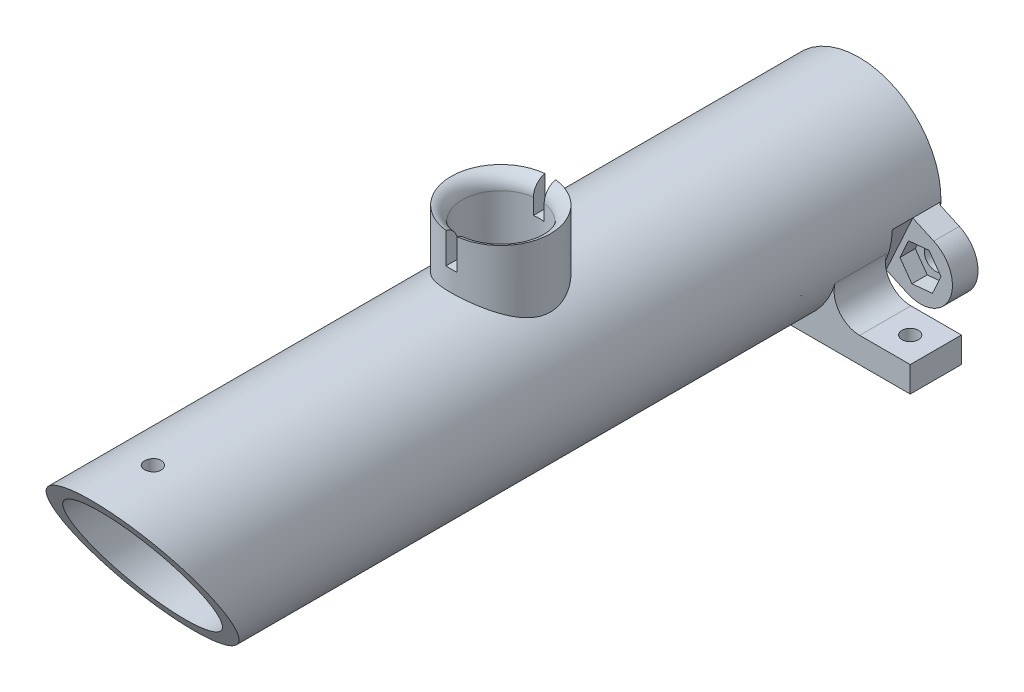
from build123d import *

# Parameters (mm, degrees)
SKETCH4_R                = 16
SKETCH4_R_2              = 13.25
BOSS_EXTRUDE3_DEPTH      = 150
BOSS_EXTRUDE4_DEPTH      = 10
BOSS_EXTRUDE4_DEPTH_BACK = 4
SKETCH6_R                = 9.7
SKETCH6_R_2              = 7.5
SKETCH7_R                = 7.5
CUT_EXTRUDE1_DEPTH       = 20
CUT_EXTRUDE2_START       = -150
SKETCH8_R                = 13.25
CUT_EXTRUDE2_DEPTH       = 150
SKETCH11_R               = 1.6
CUT_EXTRUDE5_DEPTH       = 13
CUT_EXTRUDE7_DEPTH       = 42.3
SKETCH15_W               = 60
SKETCH15_H               = 10
SKETCH15_R               = 1.6
BOSS_EXTRUDE5_DEPTH      = 5
SKETCH16_R               = 13.25
CUT_EXTRUDE8_DEPTH       = 150
FILLET2_R                = 3
FILLET3_R                = 5
CUT_EXTRUDE10_START      = 4
SKETCH20_R               = 4.747407389
SKETCH20_W               = 2.1
SKETCH20_H               = 3
CUT_EXTRUDE10_DEPTH      = 6
BOSS_EXTRUDE6_START      = -0.5
BOSS_EXTRUDE6_DEPTH      = 5
FILLET4_R                = 0.5
CUT_EXTRUDE11_DEPTH      = 4
CUT_EXTRUDE12_DEPTH      = 3


# Some blends are built 0.0001 mm under size
with BuildPart() as part:
    # Sketch4 → Boss-Extrude3 (new body)
    with BuildSketch(Plane.XY):
        Circle(SKETCH4_R)
        Circle(SKETCH4_R_2, mode=Mode.SUBTRACT)
    extrude(amount=BOSS_EXTRUDE3_DEPTH)

    # Sketch6 → Boss-Extrude4 (add, two sides: drawn at the far end of the back side and taken through both)
    with BuildSketch(Plane(origin=(0, 16, 150), x_dir=(1, 0, 0), z_dir=(0, 1, 0)).offset(-BOSS_EXTRUDE4_DEPTH_BACK)):
        with Locations(Location((0, 80, 0), (0, 0, 180))):
            Circle(SKETCH6_R)
        with Locations(Location((0, 80, 0), (0, 0, 180))):
            Circle(SKETCH6_R_2, mode=Mode.SUBTRACT)
    extrude(amount=BOSS_EXTRUDE4_DEPTH + BOSS_EXTRUDE4_DEPTH_BACK)

    # Sketch7 → Cut-Extrude1 (cut)
    with BuildSketch(Plane(origin=(0, 26, 0), x_dir=(1, 0, 0), z_dir=(0, 1, 0))):
        with Locations(Location((0, -70, 0), (0, 0, 180))):
            Circle(SKETCH7_R)
    extrude(amount=-CUT_EXTRUDE1_DEPTH, mode=Mode.SUBTRACT)

    # Sketch8 → Cut-Extrude2 (cut)
    with BuildSketch(Plane.XY.offset(150).offset(CUT_EXTRUDE2_START)):
        Circle(SKETCH8_R)
    extrude(amount=CUT_EXTRUDE2_DEPTH, mode=Mode.SUBTRACT)

    # Sketch11 → Cut-Extrude5 (cut)
    with BuildSketch(Plane(origin=(0, 16, 150), x_dir=(1, 0, 0), z_dir=(0, 1, 0))):
        with Locations(Location((0, 12, 0), (0, 0, 180))):
            Circle(SKETCH11_R)
    extrude(amount=-CUT_EXTRUDE5_DEPTH, mode=Mode.SUBTRACT)

    # Sketch14 → Cut-Extrude7 (cut)
    with BuildSketch(Plane.ZY.offset(16)):
        Polygon((150, 16), (130, -16), (150, -16), align=None)
    extrude(amount=-CUT_EXTRUDE7_DEPTH, mode=Mode.SUBTRACT)

    # Sketch15 → Boss-Extrude5 (add)
    with BuildSketch(Plane(origin=(0, -16, 150), x_dir=(-1, 0, 0), z_dir=(0, -1, 0))):
        with Locations((0, 135)):
            Rectangle(SKETCH15_W, SKETCH15_H)
        with Locations(Location((-25, 135, 0), (0, 0, 180))):
            Circle(SKETCH15_R, mode=Mode.SUBTRACT)
        with Locations(Location((25, 135, 0), (0, 0, 180))):
            Circle(SKETCH15_R, mode=Mode.SUBTRACT)
    extrude(amount=-BOSS_EXTRUDE5_DEPTH)

    # Sketch16 → Cut-Extrude8 (cut)
    with BuildSketch(Plane(origin=(0, 0, 0), x_dir=(-1, 0, 0), z_dir=(0, 0, -1))):
        with Locations(Location((0, 0, 0), (0, 0, 270))):
            Circle(SKETCH16_R)
    extrude(amount=-CUT_EXTRUDE8_DEPTH, mode=Mode.SUBTRACT)

    # Fillet2
    # the kernel refuses this fillet: 3 mm, written as the material it takes off along each edge
    with BuildSketch(Plane(origin=(0, 26, 70), x_dir=(-1, 0, 0), z_dir=(0, 0, -1))) as fillet2_piece_1:
        with BuildLine():
            CenterArc((10.5, -2.891366459), FILLET2_R, 105.466009953, 74.533990047)
            Line((7.5, -2.891366459), (7.44, -2.891366459))
            Line((7.44, -2.891366459), (7.44, 0))
            Line((7.44, 0), (7.5, 0.06))
            ThreePointArc((7.5, 0.06), (8.6, 0.06), (9.684, 0.057827329))
            Line((9.684, 0.057827329), (9.7, 0))
        make_face()
    revolve(axis=Axis((0, 26, 70), (0, 1, 0)), mode=Mode.SUBTRACT)

    # Fillet3
    fillet3_edges = [part.edges().sort_by_distance(p)[0] for p in [
        (11.618950039, -11, 15),
        (-11.618950039, -11, 15),
    ]]
    fillet(fillet3_edges, radius=FILLET3_R)

    # Sketch20 → Cut-Extrude10 (cut)
    with BuildSketch(Plane(origin=(0, 16, 150), x_dir=(1, 0, 0), z_dir=(0, 1, 0)).offset(CUT_EXTRUDE10_START)):
        with Locations((0, 80)):
            Circle(SKETCH20_R)
        with Locations((0, 88.2)):
            Rectangle(SKETCH20_W, SKETCH20_H)
        with Locations((0, 71.8)):
            Rectangle(SKETCH20_W, SKETCH20_H)
    extrude(amount=CUT_EXTRUDE10_DEPTH, mode=Mode.SUBTRACT)

    # Sketch21 → Boss-Extrude6 (add)
    with BuildSketch(Plane(origin=(0, 0, 0), x_dir=(-1, 0, 0), z_dir=(0, 0, -1)).offset(BOSS_EXTRUDE6_START)):
        with BuildLine():
            Line((-17.5, -5.75), (-17.5, -1.127899498))
            Line((-17.5, -1.127899498), (-20.098498502, -2.315784528))
            ThreePointArc((-20.098498502, -2.315784528), (-23.184215472, -10.598498502), (-14.901501498, -13.684215472))
            Line((-14.901501498, -13.684215472), (-10.796967628, -11.807857132))
            ThreePointArc((-10.796967628, -11.807857132), (-12.472856829, -10.021369294), (-13.856406461, -8))
            Line((-13.856406461, -8), (-15.25, -8))
            ThreePointArc((-15.25, -8), (-19.090990258, -9.590990258), (-17.5, -5.75))
        make_face()
        with BuildLine():
            ThreePointArc((-13.856406461, -8), (-15.396484426, -4.352960754), (-15.993964631, -0.439426187))
            Line((-15.993964631, -0.439426187), (-17.5, -1.127899498))
            Line((-17.5, -1.127899498), (-17.5, -5.75))
            ThreePointArc((-17.5, -5.75), (-15.909009742, -6.409009742), (-15.25, -8))
            Line((-15.25, -8), (-13.856406461, -8))
        make_face()
        with BuildLine():
            Line((20.098498502, -2.315784528), (17.5, -1.127899498))
            Line((17.5, -1.127899498), (17.5, -5.75))
            ThreePointArc((17.5, -5.75), (19.090990258, -6.409009742), (19.75, -8))
            ThreePointArc((19.75, -8), (17.5, -10.25), (15.25, -8))
            Line((15.25, -8), (13.856406461, -8))
            ThreePointArc((13.856406461, -8), (12.472856829, -10.021369294), (10.796967628, -11.807857132))
            Line((10.796967628, -11.807857132), (14.901501498, -13.684215472))
            ThreePointArc((14.901501498, -13.684215472), (23.184215472, -10.598498502), (20.098498502, -2.315784528))
        make_face()
        with BuildLine():
            Line((17.5, -5.75), (17.5, -1.127899498))
            Line((17.5, -1.127899498), (15.993964631, -0.439426187))
            ThreePointArc((15.993964631, -0.439426187), (15.396484426, -4.352960754), (13.856406461, -8))
            Line((13.856406461, -8), (15.25, -8))
            ThreePointArc((15.25, -8), (15.909009742, -6.409009742), (17.5, -5.75))
        make_face()
    extrude(amount=-BOSS_EXTRUDE6_DEPTH)

    # Fillet4
    fillet4_edges = [part.edges().sort_by_distance(p)[0] for p in [
        (14.551591609, -6.652156164, 0.5),
        (-14.551591609, -6.652156164, 0.5),
    ]]
    fillet(fillet4_edges, radius=FILLET4_R - 0.0001)  # a hair under: the kernel refuses the full size

    # Sketch22 → Cut-Extrude11 (cut)
    with BuildSketch(Plane.XY.offset(5.5)):
        Polygon((15.993964631, -0.439426187), (10.796967628, -11.807857132), (12.161179341, -12.431496772), (17.358176345, -1.063065827), align=None)
        Polygon((-15.993964631, -0.439426187), (-10.796967628, -11.807857132), (-12.161179341, -12.431496772), (-17.358176345, -1.063065827), align=None)
    extrude(amount=CUT_EXTRUDE11_DEPTH, mode=Mode.SUBTRACT)

    # Sketch23 → Cut-Extrude12 (cut)
    with BuildSketch(Plane.XY.offset(5.5)):
        Polygon((-19.126954006, -4.441038113), (-21.395628408, -7.629502556), (-19.768674403, -11.188464443), (-15.873045994, -11.558961887), (-13.604371592, -8.370497444), (-15.231325597, -4.811535557), align=None)
        Polygon((19.175049478, -4.335829267), (15.1642598, -4.717279233), (13.489210323, -8.381449966), (15.824950522, -11.664170733), (19.8357402, -11.282720767), (21.510789677, -7.618550034), align=None)
    extrude(amount=-CUT_EXTRUDE12_DEPTH, mode=Mode.SUBTRACT)


solid = part.part
